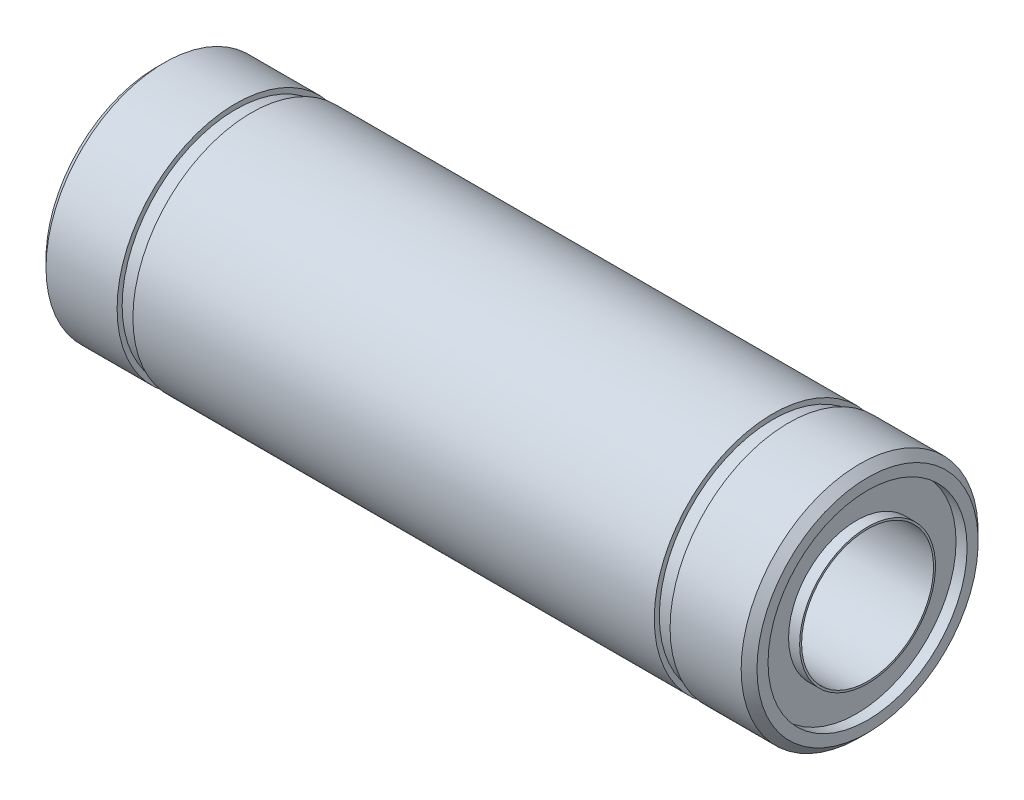
from build123d import *

# Parameters (mm, degrees)
ZKOSEN_1_SIZE = 0.5


with BuildPart() as part:
    # Skica1 → Rotovat1 (revolve)
    with BuildSketch(Plane.XY):
        Polygon((0, 4.3), (0, 4.175), (45, 4.175), (45, 4.3), (44.3, 4.3), (44.3, 6.3), (45, 6.3), (45, 7.5), (40, 7.5), (40, 7.18), (39, 7.18), (39, 7.5), (6, 7.5), (6, 7.18), (5, 7.18), (5, 7.5), (0, 7.5), (0, 6.3), (0.7, 6.3), (0.7, 4.3), align=None)
    revolve(axis=Axis((0, 0, 0), (1, 0, 0)))

    # Zkosení1
    zkosen_1_edges = [part.edges().sort_by_distance(p)[0] for p in [
        (45, -7.5, 0),
        (0, -7.5, 0),
    ]]
    chamfer(zkosen_1_edges, length=ZKOSEN_1_SIZE)


solid = part.part
